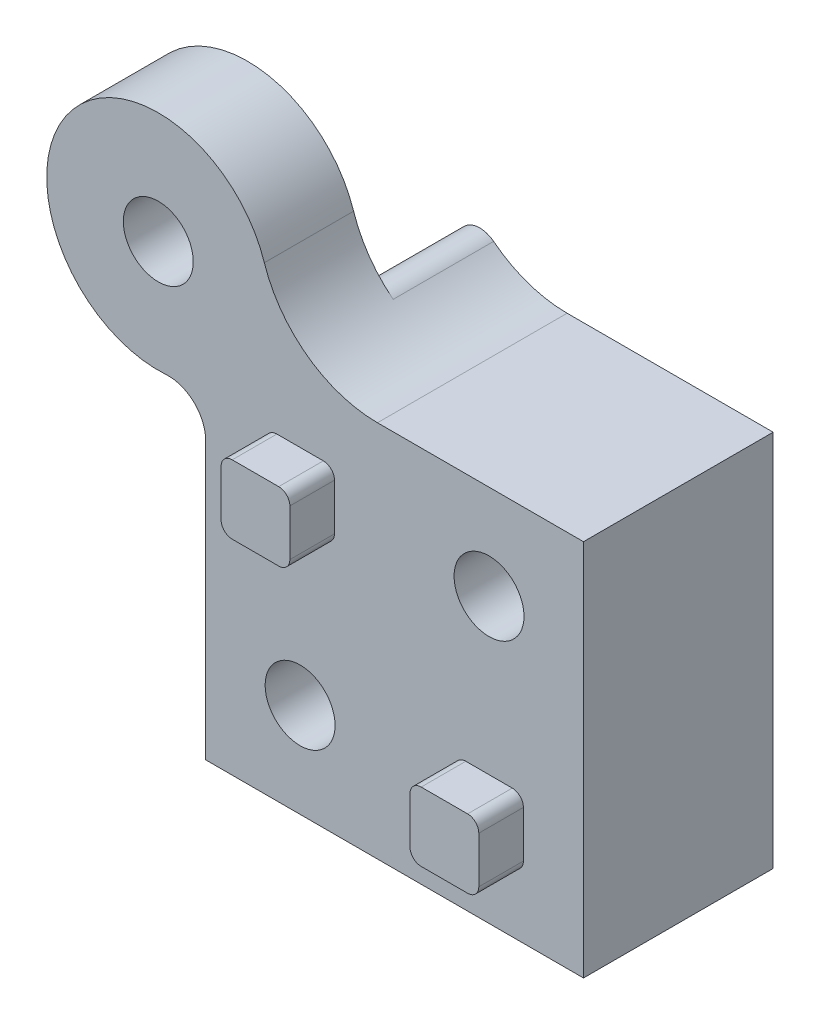
from build123d import *

# Parameters (mm, degrees)
SKETCH3_R             = 2.35
BOSS_EXTRUDE1_DEPTH   = 3
BOSS_EXTRUDE1_2_DEPTH = 3
SKETCH3_W             = 4.6228
SKETCH3_H             = 4.6228
BOSS_EXTRUDE1_3_DEPTH = 3
BOSS_EXTRUDE1_4_DEPTH = 3
SKETCH4_R             = 7.5
SKETCH4_R_2           = 2.35
SKETCH4_W             = 25.4
SKETCH4_H             = 25.4
BOSS_EXTRUDE2_DEPTH   = 6
BOSS_EXTRUDE3_DEPTH   = 6.75
SKETCH7_R             = 2.35
CUT_EXTRUDE2_DEPTH    = 224.153476458
FILLET1_R             = 8
FILLET2_R             = 2.5
FILLET3_R             = 1.5
FILLET4_R             = 0.75


with BuildPart() as part:
    # Sketch3 → Boss-Extrude1 (new body)
    with BuildSketch(Plane.XY):
        with Locations((88.913961031, 184.15)):
            Circle(SKETCH3_R)
    extrude(amount=BOSS_EXTRUDE1_DEPTH)


with BuildPart() as body_2:
    # Sketch3 → Boss-Extrude1 2 (new body)
    with BuildSketch(Plane.XY):
        with Locations((76.213961031, 171.45)):
            Circle(SKETCH3_R)
    extrude(amount=BOSS_EXTRUDE1_2_DEPTH)


with BuildPart() as body_3:
    # Sketch3 → Boss-Extrude1 3 (new body)
    with BuildSketch(Plane.XY):
        with Locations((76.213961031, 184.15)):
            Rectangle(SKETCH3_W, SKETCH3_H)
    extrude(amount=BOSS_EXTRUDE1_3_DEPTH)



with BuildPart() as body_4:
    # Sketch3 → Boss-Extrude1 4 (new body)
    with BuildSketch(Plane.XY):
        with Locations((88.913961031, 171.45)):
            Rectangle(SKETCH3_W, SKETCH3_H)
    extrude(amount=BOSS_EXTRUDE1_4_DEPTH)


with BuildPart() as body_3_1:
    add(body_3.part)

    add(body_4.part)  # Boss-Extrude2 merges body 4

    add(body_2.part)  # Boss-Extrude2 merges body 2
    # Sketch4 → Boss-Extrude2 (add)
    # profile 1 of 2: a face of its own
    with BuildSketch(Plane(origin=(0, 0, 0), x_dir=(-1, 0, 0), z_dir=(0, 0, -1))):
        with Locations((-66.681980515, 193.681980515)):
            Circle(SKETCH4_R)
        with Locations((-66.681980515, 193.681980515)):
            Circle(SKETCH4_R_2, mode=Mode.SUBTRACT)
    # profile 2 of 2: a face of its own
    with BuildSketch(Plane(origin=(0, 0, 0), x_dir=(-1, 0, 0), z_dir=(0, 0, -1))):
        with Locations((-82.563961031, 177.8)):
            Rectangle(SKETCH4_W, SKETCH4_H)
    extrude(amount=BOSS_EXTRUDE2_DEPTH)

    # Sketch6 → Boss-Extrude3 (add)
    with BuildSketch(Plane(origin=(0, 0, -6), x_dir=(-1, 0, 0), z_dir=(0, 0, -1))):
        with BuildLine():
            Line((-73.748627528, 190.5), (-95.263961031, 190.5))
            Line((-95.263961031, 190.5), (-95.263961031, 165.1))
            Line((-95.263961031, 165.1), (-69.863961031, 165.1))
            Line((-69.863961031, 165.1), (-69.863961031, 186.615333503))
            ThreePointArc((-69.863961031, 186.615333503), (-72.16205807, 188.201902961), (-73.748627528, 190.5))
        make_face()
    extrude(amount=BOSS_EXTRUDE3_DEPTH)


with BuildPart() as cut_extrude2_tool:
    # Sketch7 → Cut-Extrude2 (new, through all)
    with BuildSketch(Plane.XY.offset(3)):
        with Locations((88.913961031, 184.15)):
            Circle(SKETCH7_R)
        with Locations((76.213961031, 171.45)):
            Circle(SKETCH7_R)
    extrude(amount=-CUT_EXTRUDE2_DEPTH)


with BuildPart() as part_1:
    add(part.part)

    # Cut-Extrude2: cut by cut_extrude2_tool
    add(cut_extrude2_tool.part, mode=Mode.SUBTRACT)


with BuildPart() as body_3_2:
    add(body_3_1.part)

    # Cut-Extrude2: cut by cut_extrude2_tool
    add(cut_extrude2_tool.part, mode=Mode.SUBTRACT)

    # Fillet1
    fillet1_edges = [body_3_2.edges().sort_by_distance(p)[0] for p in [
        (73.473519369, 190.5, -3),
    ]]
    fillet(fillet1_edges, radius=FILLET1_R)

    # Fillet2
    # the kernel refuses this fillet: 2.5 mm, written as the material it adds along each edge
    with BuildSketch(Plane(origin=(69.863961031, 186.890441662, -13.962947932), x_dir=(-0.9681157623464371, -0.25050323490202075, 0), z_dir=(0, 0, 1))) as fillet2_piece_1_section:
        with BuildLine():
            CenterArc((3.218187092, 2.457364076), FILLET2_R, 165.492706976, 93.910495797)
            Line((0.797897687, 3.083622163), (0, 0))
            ThreePointArc((0, 0), (1.37922304, 0.127907773), (2.758446079, 0))
        make_face()
    fillet2_piece_1 = extrude(amount=13.962947932, mode=Mode.PRIVATE)
    fillet2_piece_1 = split(fillet2_piece_1, bisect_by=Plane(origin=(69.434424627, 185.67157625, -6), z_dir=(0, 0, -1)), keep=Keep.TOP, mode=Mode.PRIVATE)
    fillet2_piece_1 = fillet2_piece_1 - Plane(origin=(66.681980515, 193.681980515, -9.375), x_dir=(0.4105781310115351, -0.9118254209743633, 0), z_dir=(0, 0, 1)) * Cylinder(7.75, 41, mode=Mode.PRIVATE)
    fillet2_piece_1 = split(fillet2_piece_1, bisect_by=Plane(origin=(69.434424627, 185.67157625, -12.75), z_dir=(0, 0, 1)), keep=Keep.TOP, mode=Mode.PRIVATE)
    add(fillet2_piece_1)
    with BuildSketch(Plane(origin=(69.863961031, 186.890441662, -6), x_dir=(-0.9681157623464371, -0.25050323490202075, 0), z_dir=(0, 0, 1))) as fillet2_piece_2_section:
        with BuildLine():
            CenterArc((3.218187092, 2.457364076), FILLET2_R, 165.492706976, 93.910495797)
            Line((0.797897687, 3.083622163), (0, 0))
            ThreePointArc((0, 0), (1.37922304, 0.127907773), (2.758446079, 0))
        make_face()
    fillet2_piece_2 = extrude(amount=6, mode=Mode.PRIVATE)
    fillet2_piece_2 = fillet2_piece_2 & Plane(origin=(66.681980515, 193.681980515, -3), x_dir=(0.4105781310115351, -0.9118254209743633, 0), z_dir=(0, 0, 1)) * Cylinder(7.75, 25, mode=Mode.PRIVATE)
    add(fillet2_piece_2)
    with BuildSketch(Plane(origin=(69.863961031, 186.890441662, -6), x_dir=(-0.9681157623464371, -0.25050323490202075, 0), z_dir=(0, 0, 1))) as fillet2_piece_3_section:
        with BuildLine():
            CenterArc((3.218187092, 2.457364076), FILLET2_R, 165.492706976, 93.910495797)
            Line((0.797897687, 3.083622163), (0, 0))
            ThreePointArc((0, 0), (1.37922304, 0.127907773), (2.758446079, 0))
        make_face()
    fillet2_piece_3 = extrude(amount=6, mode=Mode.PRIVATE)
    fillet2_piece_3 = fillet2_piece_3 - Plane(origin=(66.681980515, 193.681980515, -3), x_dir=(0.4105781310115351, -0.9118254209743633, 0), z_dir=(0, 0, 1)) * Cylinder(7.75, 25, mode=Mode.PRIVATE)
    add(fillet2_piece_3)

    # Fillet3
    fillet3_edges = [body_3_2.edges().sort_by_distance(p)[0] for p in [
        (74.361694574, 194.723369962, -9.375),
    ]]
    fillet(fillet3_edges, radius=FILLET3_R)

    # Fillet4
    fillet4_edges = [body_3_2.edges().sort_by_distance(p)[0] for p in [
        (91.225361031, 173.7614, 1.5),
        (86.602561031, 173.7614, 1.5),
        (86.602561031, 169.1386, 1.5),
        (91.225361031, 169.1386, 1.5),
        (78.525361031, 181.8386, 1.5),
        (73.902561031, 181.8386, 1.5),
        (73.902561031, 186.4614, 1.5),
        (78.525361031, 186.4614, 1.5),
    ]]
    fillet(fillet4_edges, radius=FILLET4_R)


solid = body_3_2.part
